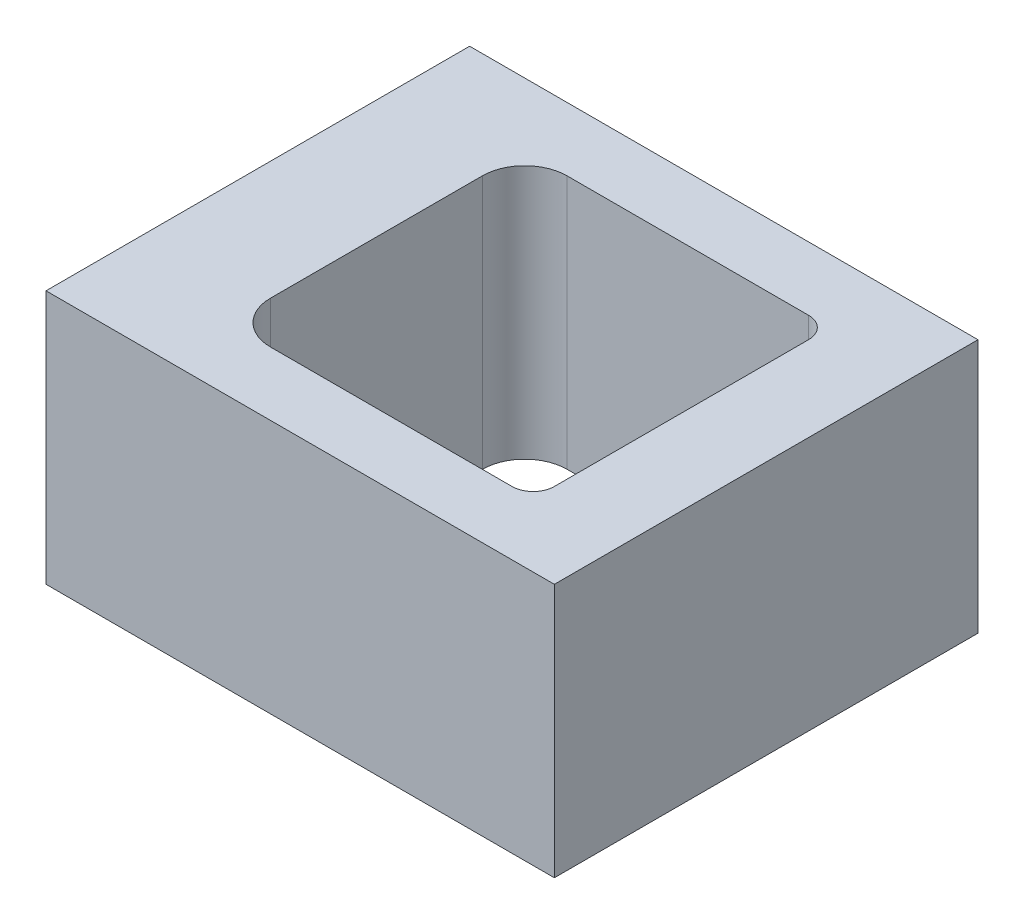
from build123d import *

# Parameters (mm, degrees)
SKETCH1_W           = 152.4
SKETCH1_H           = 127
BOSS_EXTRUDE1_DEPTH = 76.2


with BuildPart() as part:
    # Sketch1 → Boss-Extrude1 (new body)
    with BuildSketch(Plane(origin=(0, 0, 0), x_dir=(1, 0, 0), z_dir=(0, 1, 0))):
        Rectangle(SKETCH1_W, SKETCH1_H)
        with BuildLine():
            Line((-40.64, 31.75), (-40.64, -31.75))
            ThreePointArc((-40.64, -31.75), (-36.920256121, -40.730256121), (-27.94, -44.45))
            Line((-27.94, -44.45), (44.45, -44.45))
            ThreePointArc((44.45, -44.45), (48.940128061, -42.590128061), (50.8, -38.1))
            Line((50.8, -38.1), (50.8, 38.1))
            ThreePointArc((50.8, 38.1), (48.940128061, 42.590128061), (44.45, 44.45))
            Line((44.45, 44.45), (-27.94, 44.45))
            ThreePointArc((-27.94, 44.45), (-36.920256121, 40.730256121), (-40.64, 31.75))
        make_face(mode=Mode.SUBTRACT)
    extrude(amount=BOSS_EXTRUDE1_DEPTH)


solid = part.part
